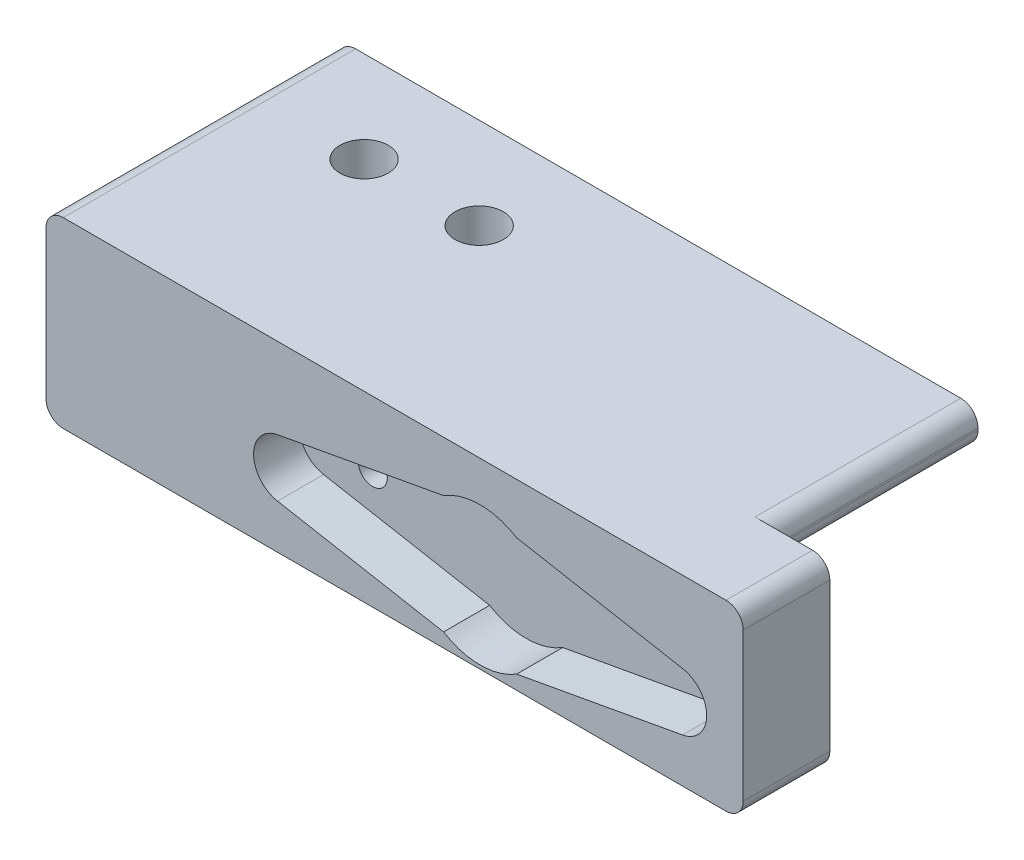
from build123d import *

# Parameters (mm, degrees)
SKETCH1_W                       = 75.438
SKETCH1_H                       = 12.7
BOSS_EXTRUDE1_DEPTH             = 6.35
CUT_EXTRUDE1_DEPTH              = 4
BOSS_EXTRUDE2_REACH             = 40.773
SKETCH3_W                       = 75.438
SKETCH3_H                       = 19.05
SKETCH3_W_2                     = 69.088
SKETCH3_H_2                     = 12.7
BOSS_EXTRUDE2_DIRECTION_2_REACH = 40.773
SKETCH4_W                       = 75.438
SKETCH4_H                       = 25.4
BOSS_EXTRUDE4_DEPTH             = 3.175
SKETCH7_W                       = 14.859
SKETCH7_H                       = 15.875
CUT_EXTRUDE3_DEPTH              = 47.460828512
SKETCH8_W                       = 3.175
SKETCH8_H                       = 15.875
CUT_EXTRUDE4_DEPTH              = 65.214043371
BOSS_EXTRUDE5_DEPTH             = 3.175
SKETCH11_W                      = 57.404
SKETCH11_H                      = 12.7
CUT_EXTRUDE5_DEPTH              = 2
SKETCH12_R                      = 1.27
CUT_EXTRUDE6_DEPTH              = 45.400547136
SKETCH10_R                      = 2.1
CUT_EXTRUDE7_DEPTH              = 45.123864983
SKETCH13_W                      = 17.875
SKETCH13_H                      = 3.175
CUT_EXTRUDE8_DEPTH              = 5
FILLET2_R                       = 1.5


with BuildPart() as part:
    # Sketch1 → Boss-Extrude1 (new body)
    with BuildSketch(Plane.XY):
        Rectangle(SKETCH1_W, SKETCH1_H)
    extrude(amount=BOSS_EXTRUDE1_DEPTH)

    # Sketch2 → Cut-Extrude1 (cut)
    with BuildSketch(Plane.XY.offset(6.35)):
        with BuildLine():
            Line((3.175, 5.129369479), (17.6006647, 2.498793645))
            ThreePointArc((17.6006647, 2.498793645), (19.685, 0), (17.6006647, -2.498793645))
            Line((17.6006647, -2.498793645), (3.175, -5.129369479))
            ThreePointArc((3.175, -5.129369479), (0, -6.0325), (-3.175, -5.129369479))
            Line((-3.175, -5.129369479), (-17.6006647, -2.498793645))
            ThreePointArc((-17.6006647, -2.498793645), (-19.685, 0), (-17.6006647, 2.498793645))
            Line((-17.6006647, 2.498793645), (-3.175, 5.129369479))
            ThreePointArc((-3.175, 5.129369479), (0, 6.0325), (3.175, 5.129369479))
        make_face()
    extrude(amount=-CUT_EXTRUDE1_DEPTH, mode=Mode.SUBTRACT)

    # Boss-Extrude2: up to this face of the body (flat: up to its plane)
    boss_extrude2_end = Plane(part.part.faces().sort_by_distance((0, 6.35, 3.175))[0])
    # Sketch3 → Boss-Extrude2 (add, up to the picked face)
    with BuildSketch(Plane(origin=(0, 0, 0), x_dir=(1, 0, 0), z_dir=(0, 1, 0)), mode=Mode.PRIVATE) as boss_extrude2_sk1:
        with Locations((0, 9.525)):
            Rectangle(SKETCH3_W, SKETCH3_H)
        with Locations((0, 9.525)):
            Rectangle(SKETCH3_W_2, SKETCH3_H_2, mode=Mode.SUBTRACT)
    boss_extrude2_tool1 = split(extrude(boss_extrude2_sk1.sketch, amount=BOSS_EXTRUDE2_REACH, mode=Mode.PRIVATE), bisect_by=boss_extrude2_end, keep=Keep.BOTH, mode=Mode.PRIVATE)
    add(boss_extrude2_tool1.solids().sort_by(Axis((0, 0, -0.778061), (0, 1, 0)))[0])

    # Boss-Extrude2 direction 2: up to this face of the body (flat: up to its plane)
    boss_extrude2_direction_2_end = Plane(part.part.faces().sort_by_distance((0, -6.35, 3.175))[0])
    # Sketch3 → Boss-Extrude2 direction 2 (add, up to the picked face)
    with BuildSketch(Plane(origin=(0, 0, 0), x_dir=(1, 0, 0), z_dir=(0, 1, 0)), mode=Mode.PRIVATE) as boss_extrude2_direction_2_sk1:
        with Locations((0, 9.525)):
            Rectangle(SKETCH3_W, SKETCH3_H)
        with Locations((0, 9.525)):
            Rectangle(SKETCH3_W_2, SKETCH3_H_2, mode=Mode.SUBTRACT)
    boss_extrude2_direction_2_tool1 = split(extrude(boss_extrude2_direction_2_sk1.sketch, amount=-BOSS_EXTRUDE2_DIRECTION_2_REACH, mode=Mode.PRIVATE), bisect_by=boss_extrude2_direction_2_end, keep=Keep.BOTH, mode=Mode.PRIVATE)
    add(boss_extrude2_direction_2_tool1.solids().sort_by(Axis((0, 0, -0.778061), (0, -1, 0)))[0])

    # Sketch4 → Boss-Extrude4 (add)
    with BuildSketch(Plane(origin=(0, 6.35, 0), x_dir=(1, 0, 0), z_dir=(0, 1, 0))):
        with Locations((0, 6.35)):
            Rectangle(SKETCH4_W, SKETCH4_H)
    extrude(amount=BOSS_EXTRUDE4_DEPTH)

    # Sketch7 → Cut-Extrude3 (cut, through all)
    with BuildSketch(Plane.XY.offset(6.35)):
        with Locations((30.2895, 1.5875)):
            Rectangle(SKETCH7_W, SKETCH7_H)
    extrude(amount=-CUT_EXTRUDE3_DEPTH, mode=Mode.SUBTRACT)

    # Sketch8 → Cut-Extrude4 (cut, through all)
    with BuildSketch(Plane(origin=(22.86, 0, 0), x_dir=(0, 0, -1), z_dir=(1, 0, 0))):
        with Locations((17.4625, 1.5875)):
            Rectangle(SKETCH8_W, SKETCH8_H)
    extrude(amount=-CUT_EXTRUDE4_DEPTH, mode=Mode.SUBTRACT)

    # Sketch9 → Boss-Extrude5 (add)
    with BuildSketch(Plane(origin=(0, 0, -15.875), x_dir=(-1, 0, 0), z_dir=(0, 0, -1))):
        Polygon((34.544, 6.35), (34.544, -6.35), (37.719, -6.35), (37.719, 9.525), (-22.86, 9.525), (-22.86, 6.35), align=None)
    extrude(amount=BOSS_EXTRUDE5_DEPTH)

    # Sketch11 → Cut-Extrude5 (cut)
    with BuildSketch(Plane(origin=(0, 0, -3.175), x_dir=(-1, 0, 0), z_dir=(0, 0, -1))):
        with Locations((5.842, 0)):
            Rectangle(SKETCH11_W, SKETCH11_H)
    extrude(amount=-CUT_EXTRUDE5_DEPTH, mode=Mode.SUBTRACT)

    # Sketch12 → Cut-Extrude6 (cut, through all)
    with BuildSketch(Plane.XY.offset(2.35)):
        with Locations((13.335, 0)):
            Circle(SKETCH12_R)
        with Locations((-13.335, 0)):
            Circle(SKETCH12_R)
    extrude(amount=-CUT_EXTRUDE6_DEPTH, mode=Mode.SUBTRACT)

    # Sketch10 → Cut-Extrude7 (cut, through all)
    with BuildSketch(Plane.XZ.offset(-6.35)):
        with Locations((-27.544, -11.1125)):
            Circle(SKETCH10_R)
        with Locations((-17.544, -11.1125)):
            Circle(SKETCH10_R)
    extrude(amount=-CUT_EXTRUDE7_DEPTH, mode=Mode.SUBTRACT)

    # Sketch13 → Cut-Extrude8 (cut)
    with BuildSketch(Plane(origin=(22.86, 0, 0), x_dir=(0, 0, -1), z_dir=(1, 0, 0))):
        with Locations((10.1125, 7.9375)):
            Rectangle(SKETCH13_W, SKETCH13_H)
    extrude(amount=-CUT_EXTRUDE8_DEPTH, mode=Mode.SUBTRACT)

    # Fillet2
    fillet2_edges = [part.edges().sort_by_distance(p)[0] for p in [
        (-37.719, 9.525, -6.35),
        (-34.544, 6.35, -10.1125),
        (-37.719, -6.35, -6.35),
        (-34.544, -6.35, -10.1125),
        (22.86, 9.525, 2.5875),
        (22.86, -6.35, 2.5875),
        (17.86, 9.525, -10.1125),
        (17.86, 6.35, -10.1125),
    ]]
    fillet(fillet2_edges, radius=FILLET2_R)


solid = part.part
